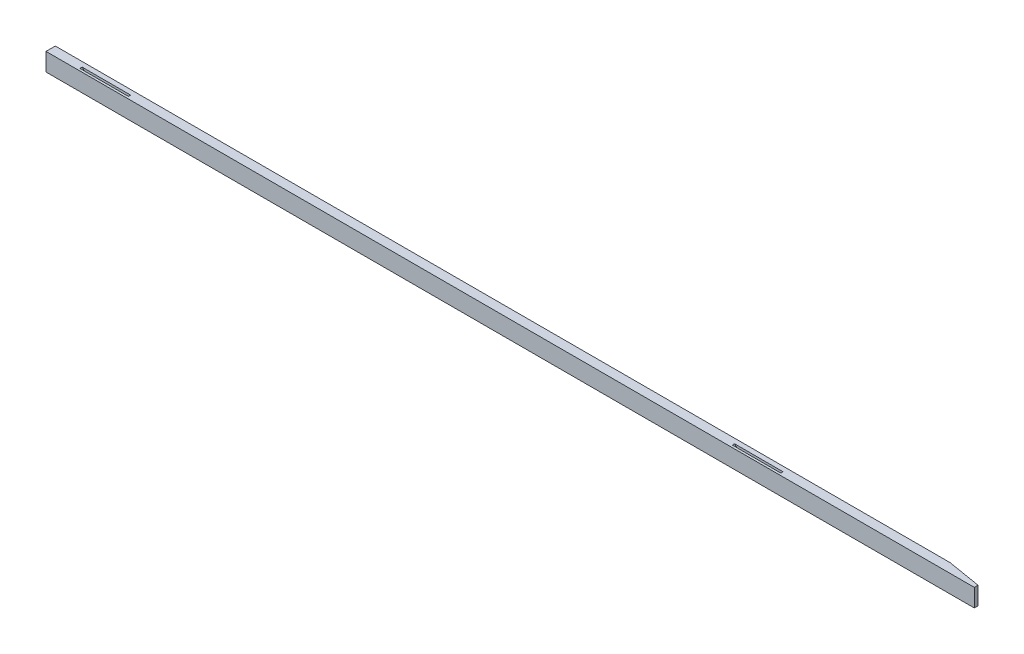
from build123d import *

# Parameters (mm, degrees)
SKETCH_1_W             = 2490
SKETCH_1_H             = 48
EXTRUDE_1_DEPTH        = 25
SKETCH_2_W             = 115
SKETCH_2_H             = 6
CUT_EXTRUDE_1_DEPTH    = 7.5
DRAFT_1_ANGLE          = 45
MIRROR_START           = 13
MIRROR_1_DEPTH         = 6
PATTERN_START          = 13
PATTERN_LINEAR_1_DEPTH = 6
CUT_EXTRUDE_2_REACH    = 2492.588


# Read off the part's stored shape, not the designer's step: 镜向1, 阵列(线性)1
with BuildPart() as part:
    # 草图1 → 凸台-拉伸1 (new body)
    with BuildSketch(Plane.XY):
        with Locations((1245, 0)):
            Rectangle(SKETCH_1_W, SKETCH_1_H)
    extrude(amount=EXTRUDE_1_DEPTH)

    # 草图2 → 切除-拉伸1 (cut)
    with BuildSketch(Plane(origin=(0, 24, 0), x_dir=(1, 0, 0), z_dir=(0, 1, 0))):
        with Locations((1900, -16)):
            Rectangle(SKETCH_2_W, SKETCH_2_H)
    extrude(amount=-CUT_EXTRUDE_1_DEPTH, mode=Mode.SUBTRACT)

    # 拔模1
    draft_1_faces = [part.faces().sort_by_distance(p)[0] for p in [
        (1957.5, 20.25, 16),
        (1842.5, 20.25, 16),
    ]]
    draft(draft_1_faces, Plane(origin=(0, 16.5, 0), x_dir=(1, 0, 0), z_dir=(0, 1, 0)), DRAFT_1_ANGLE)

    # 镜向1 outline → 镜向1 (cut)
    with BuildSketch(Plane.XY.offset(MIRROR_START)):
        Polygon((1957.5, -16.5), (1842.5, -16.5), (1835, -24), (1965, -24), align=None)
    extrude(amount=MIRROR_1_DEPTH, mode=Mode.SUBTRACT)

    # 阵列(线性)1 outline → 阵列(线性)1 (cut)
    with BuildSketch(Plane.XY.offset(PATTERN_START)):
        Polygon((215, -24), (207.5, -16.5), (92.5, -16.5), (85, -24), align=None)
        Polygon((207.5, 16.5), (215, 24), (85, 24), (92.5, 16.5), align=None)
    extrude(amount=PATTERN_LINEAR_1_DEPTH, mode=Mode.SUBTRACT)

    # 草图3 → 切除-拉伸2 (cut, up to next)
    with BuildSketch(Plane.XZ.offset(24), mode=Mode.PRIVATE) as cut_extrude_2_sk1:
        Polygon((2400, 0), (2490, 0), (2490, 15), align=None)
    cut_extrude_2_tool1 = extrude(cut_extrude_2_sk1.sketch, amount=-CUT_EXTRUDE_2_REACH, mode=Mode.PRIVATE) & part.part
    add(cut_extrude_2_tool1.solids().sort_by_distance((2460, -24, 5))[0], mode=Mode.SUBTRACT)


solid = part.part
